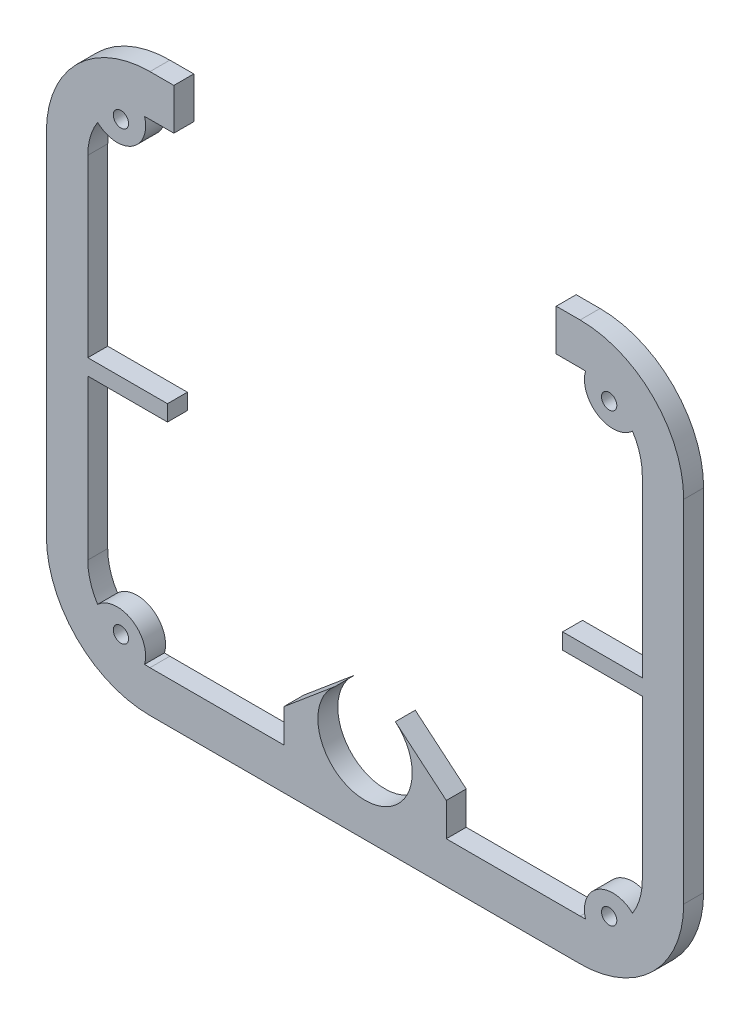
from build123d import *

# Parameters (mm, degrees)
SKETCH1_R           = 0.6096
BOSS_EXTRUDE1_DEPTH = 1.5875
CUT_EXTRUDE1_REACH  = 35.788
SKETCH2_W           = 3.155094666
SKETCH2_H           = 2.647438771
SKETCH2_W_2         = 30.48
SKETCH2_H_2         = 3.302


with BuildPart() as part:
    # Sketch1 → Boss-Extrude1 (new body)
    with BuildSketch(Plane.XY):
        with BuildLine():
            ThreePointArc((25.4, 13.97), (22.982166479, 19.807166479), (17.145, 22.225))
            Line((17.145, 22.225), (-17.145, 22.225))
            ThreePointArc((-17.145, 22.225), (-22.982166479, 19.807166479), (-25.4, 13.97))
            Line((-25.4, 13.97), (-25.4, -13.97))
            ThreePointArc((-25.4, -13.97), (-22.982166479, -19.807166479), (-17.145, -22.225))
            Line((-17.145, -22.225), (17.145, -22.225))
            ThreePointArc((17.145, -22.225), (22.982166479, -19.807166479), (25.4, -13.97))
            Line((25.4, -13.97), (25.4, 13.97))
        make_face()
        with Locations((-19.457528855, -17.78)):
            Circle(SKETCH1_R, mode=Mode.SUBTRACT)
        with BuildLine():
            ThreePointArc((-17.571441005, -18.904608097), (-18.58472515, -16.350943325), (-21.316849854, -16.639808568))
            ThreePointArc((-21.316849854, -16.639808568), (-21.898702837, -15.360869633), (-22.098, -13.97))
            Line((-22.098, -13.97), (-22.098, -1.27))
            Line((-22.098, -1.27), (-15.748, -1.27))
            Line((-15.748, -1.27), (-15.748, 0))
            Line((-15.748, 0), (-22.098, 0))
            Line((-22.098, 0), (-22.098, 13.97))
            ThreePointArc((-22.098, 13.97), (-21.898702837, 15.360869633), (-21.316849854, 16.639808568))
            ThreePointArc((-21.316849854, 16.639808568), (-18.58472515, 16.350943325), (-17.571441005, 18.904608097))
            ThreePointArc((-17.571441005, 18.904608097), (-17.358418716, 18.918399888), (-17.145, 18.923))
            Line((-17.145, 18.923), (17.145, 18.923))
            ThreePointArc((17.145, 18.923), (17.358418716, 18.918399888), (17.571441005, 18.904608097))
            ThreePointArc((17.571441005, 18.904608097), (18.58472515, 16.350943325), (21.316849854, 16.639808568))
            ThreePointArc((21.316849854, 16.639808568), (21.898702837, 15.360869633), (22.098, 13.97))
            Line((22.098, 13.97), (22.098, 0))
            Line((22.098, 0), (15.748, 0))
            Line((15.748, 0), (15.748, -1.27))
            Line((15.748, -1.27), (22.098, -1.27))
            Line((22.098, -1.27), (22.098, -13.97))
            ThreePointArc((22.098, -13.97), (21.898702837, -15.360869633), (21.316849854, -16.639808568))
            ThreePointArc((21.316849854, -16.639808568), (18.58472515, -16.350943325), (17.571441005, -18.904608097))
            ThreePointArc((17.571441005, -18.904608097), (17.358418716, -18.918399888), (17.145, -18.923))
            Line((17.145, -18.923), (9.632094666, -18.923))
            Line((9.632094666, -18.923), (2.416367182, -12.868285729))
            ThreePointArc((2.416367182, -12.868285729), (0, -19.5072), (-2.416367182, -12.868285729))
            Line((-2.416367182, -12.868285729), (-9.632094666, -18.923))
            Line((-9.632094666, -18.923), (-17.145, -18.923))
            ThreePointArc((-17.145, -18.923), (-17.358418716, -18.918399888), (-17.571441005, -18.904608097))
        make_face(mode=Mode.SUBTRACT)
        with Locations((19.457528855, -17.78)):
            Circle(SKETCH1_R, mode=Mode.SUBTRACT)
        with Locations((19.457528855, 17.78)):
            Circle(SKETCH1_R, mode=Mode.SUBTRACT)
        with Locations((-19.457528855, 17.78)):
            Circle(SKETCH1_R, mode=Mode.SUBTRACT)
    extrude(amount=BOSS_EXTRUDE1_DEPTH)

    # Sketch2 → Cut-Extrude1 (cut, up to next)
    with BuildSketch(Plane.XY.offset(1.5875), mode=Mode.PRIVATE) as cut_extrude1_sk1:
        with Locations((-8.054547333, -17.599280615)):
            Rectangle(SKETCH2_W, SKETCH2_H)
    cut_extrude1_tool1 = extrude(cut_extrude1_sk1.sketch, amount=-CUT_EXTRUDE1_REACH, mode=Mode.PRIVATE) & part.part
    # Sketch2 → Cut-Extrude1 (cut, up to next)
    with BuildSketch(Plane.XY.offset(1.5875), mode=Mode.PRIVATE) as cut_extrude1_sk2:
        with Locations((8.054547333, -17.599280615)):
            Rectangle(SKETCH2_W, SKETCH2_H)
    cut_extrude1_tool2 = extrude(cut_extrude1_sk2.sketch, amount=-CUT_EXTRUDE1_REACH, mode=Mode.PRIVATE) & part.part
    # Sketch2 → Cut-Extrude1 (cut, up to next)
    with BuildSketch(Plane.XY.offset(1.5875), mode=Mode.PRIVATE) as cut_extrude1_sk3:
        with Locations((0, 20.574)):
            Rectangle(SKETCH2_W_2, SKETCH2_H_2)
    cut_extrude1_tool3 = extrude(cut_extrude1_sk3.sketch, amount=-CUT_EXTRUDE1_REACH, mode=Mode.PRIVATE) & part.part
    add(cut_extrude1_tool1.solids().sort_by_distance((-8.054547, -17.599281, 1.5875))[0], mode=Mode.SUBTRACT)
    add(cut_extrude1_tool2.solids().sort_by_distance((8.054547, -17.599281, 1.5875))[0], mode=Mode.SUBTRACT)
    add(cut_extrude1_tool3.solids().sort_by_distance((0, 20.574, 1.5875))[0], mode=Mode.SUBTRACT)


solid = part.part
